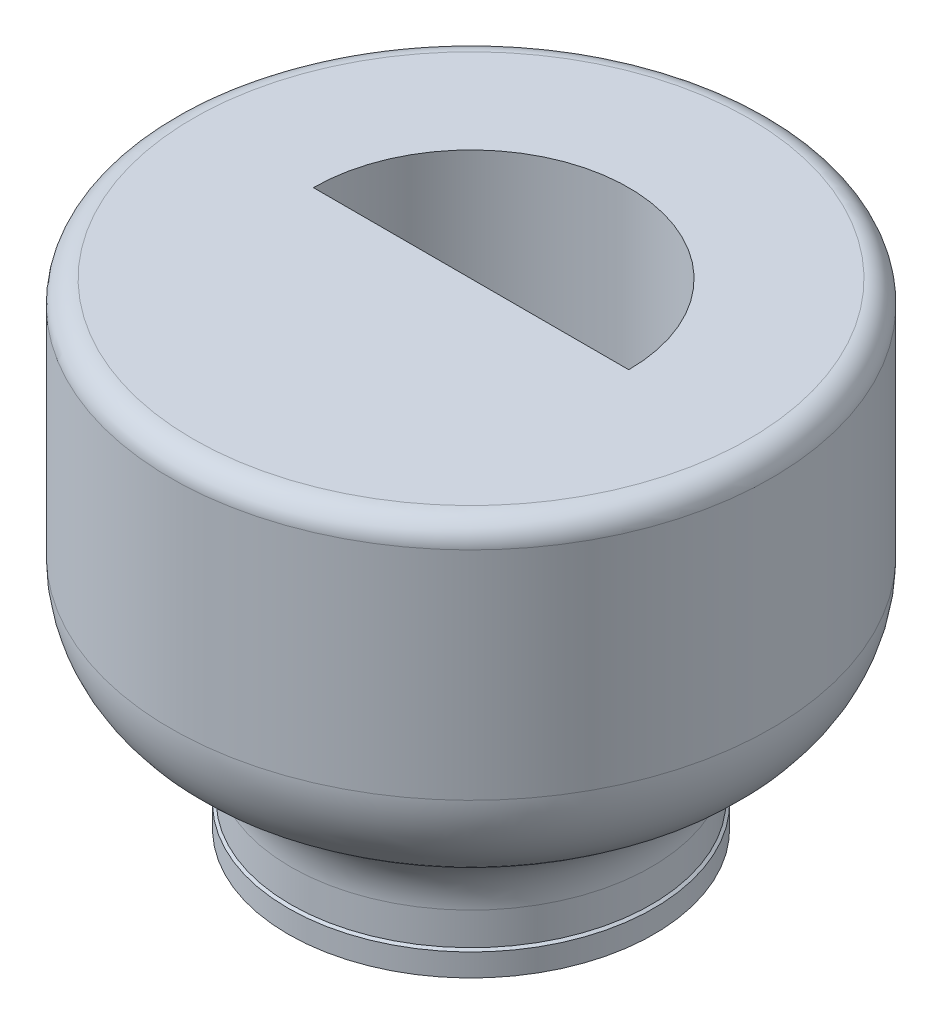
from build123d import *

# Parameters (mm, degrees)
CUT_EXTRUDE3_DEPTH = 60


with BuildPart() as part:
    # Sketch1 → Revolve1 (revolve)
    with BuildSketch(Plane.XY):
        with BuildLine():
            Line((0, 63.427876097), (37, 63.427876097))
            ThreePointArc((37, 63.427876097), (39.121320344, 62.54919644), (40, 60.427876097))
            Line((40, 60.427876097), (40, 31.556288966))
            ThreePointArc((40, 31.556288966), (38.188122658, 24.409721904), (33.190210564, 18.989648567))
            Line((33.190210564, 18.989648567), (28.539859624, 15.958818353))
            ThreePointArc((28.539859624, 15.958818353), (25.207918228, 12.345436129), (24, 7.581058088))
            Line((24, 7.581058088), (24, 3.25))
            Line((24, 3.25), (24.35, 3))
            Line((24.35, 3), (24.35, 0))
            Line((24.35, 0), (22.5, 0))
            Line((22.5, 0), (22.5, 12.5))
            ThreePointArc((22.5, 12.5), (22.353553391, 12.853553391), (22, 13))
            Line((22, 13), (0, 13))
            Line((0, 13), (0, 63.427876097))
        make_face()
    revolve(axis=Axis((0, 0, 0), (0, 1, 0)))

    # Sketch11 → Cut-Extrude3 (cut)
    with BuildSketch(Plane(origin=(0, 13, 0), x_dir=(-1, 0, 0), z_dir=(0, -1, 0))):
        with BuildLine():
            Line((-21, 0), (21, 0))
            ThreePointArc((21, 0), (0, 21), (-21, 0))
        make_face()
    extrude(amount=-CUT_EXTRUDE3_DEPTH, mode=Mode.SUBTRACT)


solid = part.part
